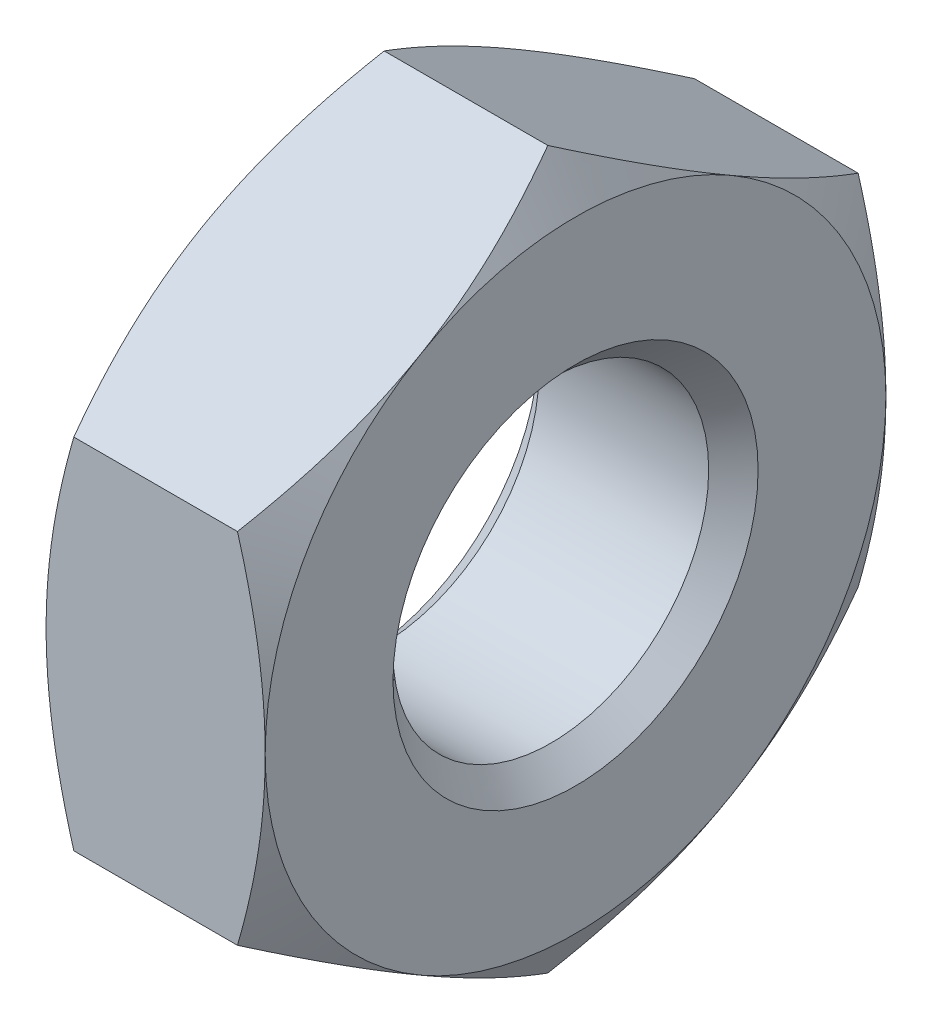
from build123d import *

# Parameters (mm, degrees)
CUT_EXTRUDE_1_DEPTH      = 3
CUT_EXTRUDE_1_DEPTH_BACK = 3
SKETCH_3_W               = 34
SKETCH_3_H               = 34


with BuildPart() as part:
    # 草图1 → 旋转1 (revolve)
    with BuildSketch(Plane.XY):
        Polygon((-3, 0), (-3, 8.5), (-2.018504542, 10.2), (2.018504542, 10.2), (3, 8.5), (3, 0), align=None)
    revolve(axis=Axis((3, 0, 0), (-1, 0, 0)))

    # 草图2 → 切除-旋转1 (revolve, cut)
    with BuildSketch(Plane.XY):
        Polygon((-3, 0), (-3, 5), (-2.3235, 4.3235), (2.3235, 4.3235), (3, 5), (3, 0), align=None)
    revolve(axis=Axis((3, 0, 0), (-1, 0, 0)), mode=Mode.SUBTRACT)

    # 草图3 → 切除-拉伸1 (cut, two sides: drawn at the far end of the back side and taken through both)
    with BuildSketch(Plane(origin=(0, 0, 0), x_dir=(0, 0, -1), z_dir=(1, 0, 0)).offset(-CUT_EXTRUDE_1_DEPTH_BACK)):
        Rectangle(SKETCH_3_W, SKETCH_3_H)
        Polygon((-8.5, -4.907477288), (0, -9.814954576), (8.5, -4.907477288), (8.5, 4.907477288), (0, 9.814954576), (-8.5, 4.907477288), align=None, mode=Mode.SUBTRACT)
    extrude(amount=CUT_EXTRUDE_1_DEPTH + CUT_EXTRUDE_1_DEPTH_BACK, mode=Mode.SUBTRACT)


solid = part.part
